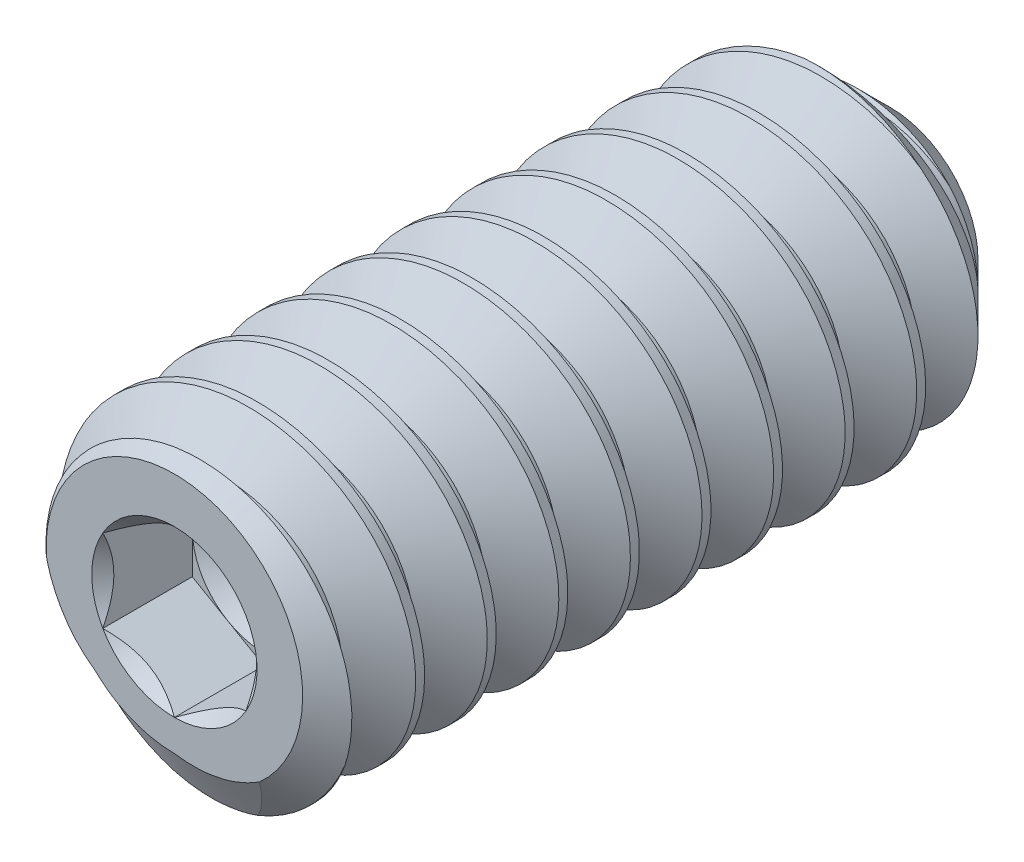
from build123d import *

# Parameters (mm, degrees)
CUT_SWEEP2_PITCH    = 0.635
CUT_EXTRUDE10_DEPTH = 0.79375


with BuildPart() as part:
    # Sketch22 → Revolve1 (revolve)
    with BuildSketch(Plane(origin=(0, 0, 0), x_dir=(0, 0, -1), z_dir=(1, 0, 0)), mode=Mode.PRIVATE) as revolve1_sk:
        Polygon((-2.940837021, 0), (-2.940837021, 1.13792), (-2.741641981, 1.4224), (2.766188262, 1.4224), (3.409162979, 0.779425283), (2.940837021, 0), align=None)
    revolve(revolve1_sk.sketch.rotate(Axis((0, 0, -2.940837021), (0, 0, -1)), 180), axis=Axis((0, 0, -2.940837021), (0, 0, -1)))

    # Cut-Sweep2: the profile of Sketch28 profile screwed along a right-hand helix of 11 turns, 6 arcs to a turn; built about Z, then put on its axis
    cut_sweep2_z = Axis((0, 0, 0), (0, 0, 1))
    cut_sweep2_corners = [(1.4227, 0, 0.000173205), (1.4227, 0, -0.555798205), (1.009955401, 0, -0.3175), (1.009955401, 0, -0.238125)]
    with BuildLine(mode=Mode.PRIVATE) as cut_sweep2_profile:
        Line(cut_sweep2_corners[0], cut_sweep2_corners[1])
        Line(cut_sweep2_corners[1], cut_sweep2_corners[2])
        Line(cut_sweep2_corners[2], cut_sweep2_corners[3])
        Line(cut_sweep2_corners[3], cut_sweep2_corners[0])
    cut_sweep2_cap = Face(cut_sweep2_profile.wire())
    cut_sweep2_turn_angles = [0, 30, 60, 90, 120, 150, 180, 210, 240, 270, 300, 330, 360]
    cut_sweep2_turn_weights = [1, 0.8660254037844387, 1, 0.8660254037844387, 1, 0.8660254037844387, 1, 0.8660254037844387, 1, 0.8660254037844387, 1, 0.8660254037844387, 1]
    cut_sweep2_turn_rails = [Edge.make_bspline([Vector(p[0], p[1], 0).rotate(cut_sweep2_z, cut_sweep2_turn_angles[k]) / cut_sweep2_turn_weights[k] + Vector(0, 0, p[2] + CUT_SWEEP2_PITCH * cut_sweep2_turn_angles[k] / 360) for k in range(13)], [0, 0, 0, 1, 1, 2, 2, 3, 3, 4, 4, 5, 5, 6, 6, 6], 2, cut_sweep2_turn_weights) for p in cut_sweep2_corners]
    cut_sweep2_turn_sides = [Face.make_surface_from_curves(cut_sweep2_turn_rails[p[0]], cut_sweep2_turn_rails[p[1]]) for p in [(0, 1), (1, 2), (2, 3), (3, 0)]]
    cut_sweep2 = Plane(origin=(0, 0, -3.409162979), x_dir=(0, 1, 0), z_dir=(0, 0, 1)) * Solid(Shell([*[p.moved(Location((0, 0, CUT_SWEEP2_PITCH * i))) for i in range(11) for p in cut_sweep2_turn_sides], cut_sweep2_cap, cut_sweep2_cap.rotate(cut_sweep2_z, 3960).moved(Location((0, 0, CUT_SWEEP2_PITCH * 3960 / 360)))]))
    add(cut_sweep2, mode=Mode.SUBTRACT)

    # Sketch23 → Cut-Extrude10 (cut)
    with BuildSketch(Plane.XY.offset(2.940837021)):
        Polygon((0, 0.733234842), (-0.635, 0.366617421), (-0.635, -0.366617421), (0, -0.733234842), (0.635, -0.366617421), (0.635, 0.366617421), align=None)
    extrude(amount=-CUT_EXTRUDE10_DEPTH, mode=Mode.SUBTRACT)

    # Cut-Extrude11 cone 1 section (through the dimple's axis) → Cut-Extrude11 (revolve, cut)
    with BuildSketch(Plane(origin=(0, 0, 2.940837021), x_dir=(0, -1, 0), z_dir=(1, 0, 0))):
        Polygon((0, 0), (0.733234842, 0), (0, 0.733234842), align=None)
    revolve(axis=Axis((0, 0, 2.940837021), (0, 0, -1)), mode=Mode.SUBTRACT)

    # Cut-Extrude12 cone 1 section (through the dimple's axis) → Cut-Extrude12 (revolve, cut)
    with BuildSketch(Plane(origin=(0, 0, 2.147087021), x_dir=(0, -1, 0), z_dir=(1, 0, 0))):
        Polygon((0, 0), (0.635, 0), (0, 0.366617421), align=None)
    revolve(axis=Axis((0, 0, 2.147087021), (0, 0, -1)), mode=Mode.SUBTRACT)


solid = part.part
